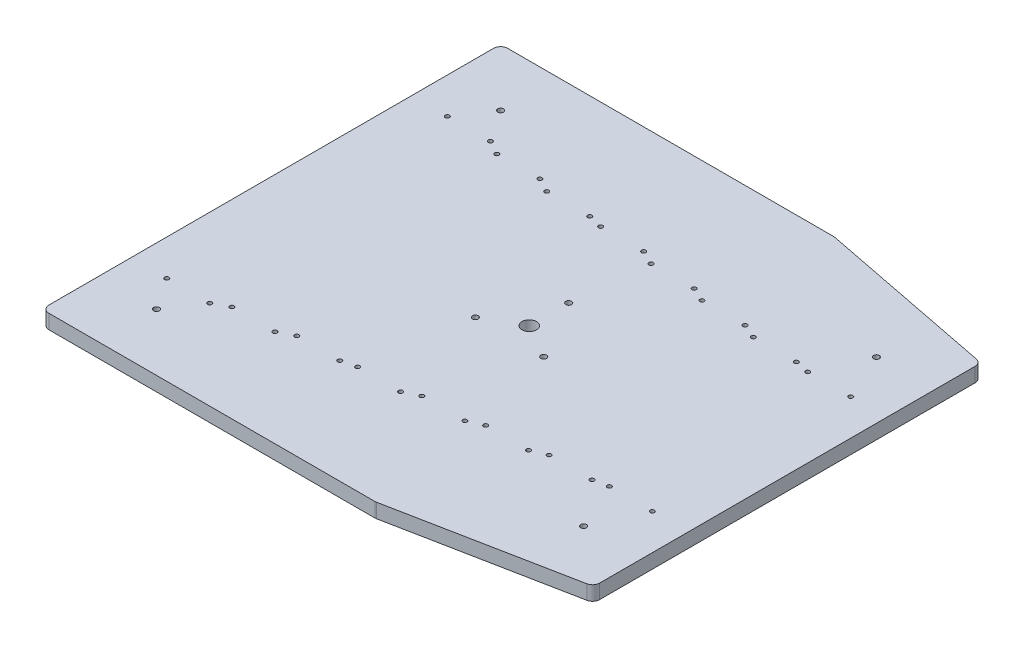
from build123d import *

# Parameters (mm, degrees)
SKETCH1_W              = 457.2
SKETCH1_H              = 406.4
BOSS_EXTRUDE1_DEPTH    = 12.7
F_6_CLEARANCE_HOLE1_D  = 3.7973
SKETCH5_R              = 6.4135
CUT_EXTRUDE2_DEPTH     = 307.120058147
CUT_EXTRUDE3_DEPTH     = 3.175
F_10_CLEARANCE_HOLE1_D = 5.1054
CUT_EXTRUDE4_DEPTH     = 307.120058147
FILLET1_R              = 6.35
F_10_CLEARANCE_HOLE2_D = 5.1054


with BuildPart() as part:
    # Sketch1 → Boss-Extrude1 (new body)
    with BuildSketch(Plane(origin=(0, 0, 0), x_dir=(1, 0, 0), z_dir=(0, 1, 0))):
        Rectangle(SKETCH1_W, SKETCH1_H)
    extrude(amount=BOSS_EXTRUDE1_DEPTH)

    # #6 Clearance Hole1 (through all)
    with Locations(Plane(origin=(0, 0, 0), x_dir=(-1, 0, 0), z_dir=(0, -1, 0))):
        with Locations((-196.85, 87.87638), (-158.75, 87.87638), (-146.05, 90.45448), (-107.95, 90.45448), (-95.25, 95.83166), (-57.15, 95.83166), (-44.45, 101.50348), (-6.35, 101.50348), (6.35, 107.61726), (44.45, 107.61726), (57.15, 110.71098), (95.25, 110.71098), (107.95, 117.34038), (146.05, 117.34038), (158.75, 124.26442), (196.85, 124.26442), (196.85, -124.26442), (158.75, -124.26442), (146.05, -117.34038), (107.95, -117.34038), (95.25, -110.71098), (57.15, -110.71098), (44.45, -107.61726), (6.35, -107.61726), (-6.35, -101.50348), (-44.45, -101.50348), (-57.15, -95.83166), (-95.25, -95.83166), (-107.95, -90.45448), (-146.05, -90.45448), (-158.75, -87.87638), (-196.85, -87.87638)):
            Hole(F_6_CLEARANCE_HOLE1_D / 2)

    # Sketch5 → Cut-Extrude2 (cut, through all)
    with BuildSketch(Plane.XZ):
        Circle(SKETCH5_R)
    extrude(amount=-CUT_EXTRUDE2_DEPTH, mode=Mode.SUBTRACT)

    # Sketch6 → Cut-Extrude3 (cut)
    with BuildSketch(Plane.XZ):
        Polygon((-192.913, -121.99139199), (-196.85, -119.71836398), (-200.787, -121.99139199), (-200.787, -126.53744801), (-196.85, -128.81047602), (-192.913, -126.53744801), align=None)
    cut_extrude3 = extrude(amount=-CUT_EXTRUDE3_DEPTH, mode=Mode.SUBTRACT)

    # Sketch-Pattern1: Cut-Extrude3 at 31 more places
    with Locations((393.7, 0, 36.38804), (355.6, 0, 36.38804), (342.9, 0, 33.80994), (304.8, 0, 33.80994), (292.1, 0, 28.43276), (254, 0, 28.43276), (241.3, 0, 22.76094), (203.2, 0, 22.76094), (190.5, 0, 16.64716), (152.4, 0, 16.64716), (139.7, 0, 13.55344), (101.6, 0, 13.55344), (88.9, 0, 6.92404), (50.8, 0, 6.92404), (38.1, 0, 0), (0, 0, 248.52884), (38.1, 0, 248.52884), (50.8, 0, 241.6048), (88.9, 0, 241.6048), (101.6, 0, 234.9754), (139.7, 0, 234.9754), (152.4, 0, 231.88168), (190.5, 0, 231.88168), (203.2, 0, 225.7679), (241.3, 0, 225.7679), (254, 0, 220.09608), (292.1, 0, 220.09608), (304.8, 0, 214.7189), (342.9, 0, 214.7189), (355.6, 0, 212.1408), (393.7, 0, 212.1408)):
        add(cut_extrude3, mode=Mode.SUBTRACT)

    # #10 Clearance Hole1 (through all)
    with Locations(Plane(origin=(0, 12.7, 0), x_dir=(1, 0, 0), z_dir=(0, 1, 0))):
        with Locations((-30.245937227, -17.4625), (0, 34.925), (30.245937227, -17.4625)):
            Hole(F_10_CLEARANCE_HOLE1_D / 2)

    # Sketch10 → Cut-Extrude4 (cut, through all)
    with BuildSketch(Plane(origin=(0, 12.7, 0), x_dir=(1, 0, 0), z_dir=(0, 1, 0))):
        Polygon((67.035234154, -203.2), (228.6, -171.45), (228.6, -203.2), align=None)
        Polygon((228.6, 203.2), (67.035234154, 203.2), (228.6, 171.45), align=None)
    extrude(amount=-CUT_EXTRUDE4_DEPTH, mode=Mode.SUBTRACT)

    # Fillet1
    fillet1_edges = [part.edges().sort_by_distance(p)[0] for p in [
        (-228.6, 6.35, 203.2),
        (-228.6, 6.35, -203.2),
        (228.6, 6.35, -171.45),
        (228.6, 6.35, 171.45),
        (67.035234154, 6.35, -203.2),
        (67.035234154, 6.35, 203.2),
    ]]
    fillet(fillet1_edges, radius=FILLET1_R)

    # #10 Clearance Hole2 (through all)
    with Locations(Plane(origin=(0, 12.7, 0), x_dir=(1, 0, 0), z_dir=(0, 1, 0))):
        with Locations((177.8, -129.661378082), (-177.8, -152.4), (-177.8, 152.4), (177.8, 129.661378082)):
            Hole(F_10_CLEARANCE_HOLE2_D / 2)


solid = part.part
